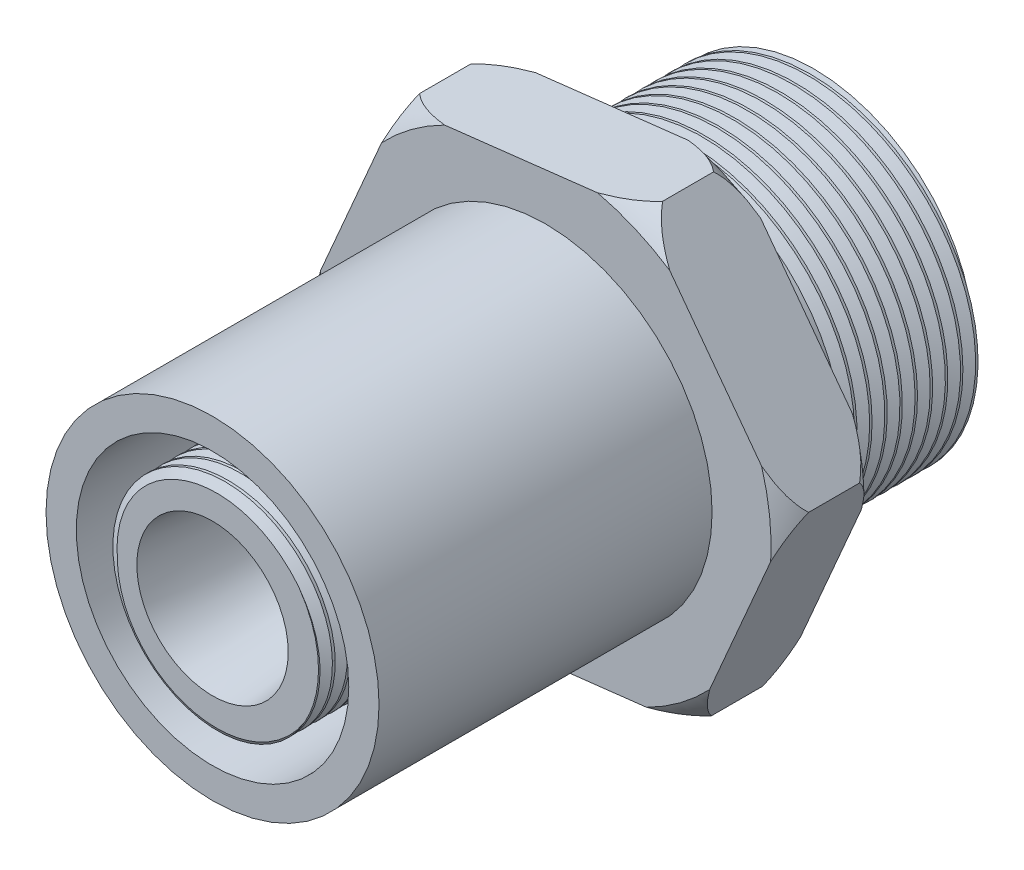
from build123d import *

# Parameters (mm, degrees)
SKETCH1_R           = 2.75
BOSS_EXTRUDE1_DEPTH = 10
CUT_SWEEP1_PITCH    = 0.25
SKETCH4_R           = 3.488114234
SKETCH4_R_2         = 2.4
CUT_EXTRUDE2_DEPTH  = 0.5
BOSS_EXTRUDE3_DEPTH = 1.5
SKETCH7_R           = 0.5
CUT_EXTRUDE3_DEPTH  = 11.5
SKETCH8_R           = 1.25
CUT_EXTRUDE4_DEPTH  = 5.5
CUT_EXTRUDE4_DRAFT  = -6
SKETCH9_R           = 1.25
CUT_EXTRUDE5_DEPTH  = 2
SKETCH12_R          = 2.25
SKETCH12_R_2        = 1.75
CUT_EXTRUDE6_DEPTH  = 4
CUT_SWEEP3_PITCH    = 0.25


with BuildPart() as part:
    # Sketch1 → Boss-Extrude1 (new body)
    with BuildSketch(Plane.XY):
        Circle(SKETCH1_R)
    extrude(amount=BOSS_EXTRUDE1_DEPTH)

    # Cut-Sweep1: arcs per turn and ends read off the stored shape
    # Cut-Sweep1: the profile of Sketch3 screwed along a right-hand helix through 11 turns, 6 arcs to a turn; built about Z, then put on its axis
    cut_sweep1_z = Axis((0, 0, 0), (0, 0, 1))
    cut_sweep1_corners = [(2.567921771, -4.9616e-05, -0.246570801), (2.75844736, -0.001640999, -0.136582313), (2.75844736, 0.001541767, -0.356559289)]
    with BuildLine(mode=Mode.PRIVATE) as cut_sweep1_profile:
        Line(cut_sweep1_corners[0], cut_sweep1_corners[1])
        Line(cut_sweep1_corners[1], cut_sweep1_corners[2])
        Line(cut_sweep1_corners[2], cut_sweep1_corners[0])
    cut_sweep1_cap = Face(cut_sweep1_profile.wire())
    cut_sweep1_turn_angles = [0, 30, 60, 90, 120, 150, 180, 210, 240, 270, 300, 330, 360]
    cut_sweep1_turn_weights = [1, 0.8660254037844387, 1, 0.8660254037844387, 1, 0.8660254037844387, 1, 0.8660254037844387, 1, 0.8660254037844387, 1, 0.8660254037844387, 1]
    cut_sweep1_turn_rails = [Edge.make_bspline([Vector(p[0], p[1], 0).rotate(cut_sweep1_z, cut_sweep1_turn_angles[k]) / cut_sweep1_turn_weights[k] + Vector(0, 0, p[2] + CUT_SWEEP1_PITCH * cut_sweep1_turn_angles[k] / 360) for k in range(13)], [0, 0, 0, 1, 1, 2, 2, 3, 3, 4, 4, 5, 5, 6, 6, 6], 2, cut_sweep1_turn_weights) for p in cut_sweep1_corners]
    cut_sweep1_turn_sides = [Face.make_surface_from_curves(cut_sweep1_turn_rails[p[0]], cut_sweep1_turn_rails[p[1]]) for p in [(0, 1), (1, 2), (2, 0)]]
    cut_sweep1 = Plane(origin=(0, 0, 0), x_dir=(1, 0, 0), z_dir=(0, 0, 1)) * Solid(Shell([*[p.moved(Location((0, 0, CUT_SWEEP1_PITCH * i))) for i in range(11) for p in cut_sweep1_turn_sides], cut_sweep1_cap, cut_sweep1_cap.rotate(cut_sweep1_z, 3960).moved(Location((0, 0, CUT_SWEEP1_PITCH * 3960 / 360)))]))
    add(cut_sweep1, mode=Mode.SUBTRACT)

    # Sketch4 → Cut-Extrude2 (cut)
    with BuildSketch(Plane(origin=(0, 0, 2.5), x_dir=(-1, 0, 0), z_dir=(0, 0, -1))):
        Circle(SKETCH4_R)
        Circle(SKETCH4_R_2, mode=Mode.SUBTRACT)
    extrude(amount=-CUT_EXTRUDE2_DEPTH, mode=Mode.SUBTRACT)

    # Sketch5 → Boss-Extrude3 (add)
    with BuildSketch(Plane(origin=(0, 0, 3), x_dir=(-1, 0, 0), z_dir=(0, 0, -1))):
        Polygon((-1.602981339, 3.709957434), (-4.014408054, 0.466756156), (-2.411426715, -3.243201278), (1.602981339, -3.709957434), (4.014408054, -0.466756156), (2.411426715, 3.243201278), align=None)
    extrude(amount=-BOSS_EXTRUDE3_DEPTH)

    # Sketch7 → Cut-Extrude3 (cut)
    with BuildSketch(Plane(origin=(0, 0, 0), x_dir=(-1, 0, 0), z_dir=(0, 0, -1))):
        Circle(SKETCH7_R)
    extrude(amount=-CUT_EXTRUDE3_DEPTH, mode=Mode.SUBTRACT)


with BuildPart() as cut_extrude4_tool:
    # Sketch8 → Cut-Extrude4 (with draft: the straight prism first)
    with BuildSketch(Plane.XY.offset(10)):
        Circle(SKETCH8_R)
    extrude(amount=-CUT_EXTRUDE4_DEPTH)
    # Cut-Extrude4: the draft: its side faces are tilted about the plane it starts from
    cut_extrude4_sides = [cut_extrude4_tool.faces().sort_by_distance(p)[0] for p in [
        (-1.25, 0, 7.25),
    ]]
    draft(cut_extrude4_sides, Plane.XY.offset(10), CUT_EXTRUDE4_DRAFT)


with BuildPart() as part_1:
    add(part.part)

    # Cut-Extrude4: cut by cut_extrude4_tool
    add(cut_extrude4_tool.part, mode=Mode.SUBTRACT)

    # Sketch9 → Cut-Extrude5 (cut)
    with BuildSketch(Plane(origin=(0, 0, 0), x_dir=(-1, 0, 0), z_dir=(0, 0, -1))):
        Circle(SKETCH9_R)
    extrude(amount=-CUT_EXTRUDE5_DEPTH, mode=Mode.SUBTRACT)

    # Cut-Sweep2: sweep along a path in Sketch10
    with BuildLine(Plane(origin=(0, 0, 3), x_dir=(-1, 0, 0), z_dir=(0, 0, -1))) as cut_sweep2_path:
        CenterArc((0, 0), 4.041451884, 0, 360)
    # Sketch11 → Cut-Sweep2 (sweep, cut)
    with BuildSketch(Plane(origin=(0, 0, 0), x_dir=(0, 0, -1), z_dir=(0.9179763956204893, -0.3966350174702367, 0))):
        with BuildLine():
            Line((-2.834975364, -3.12860287), (-2.834975364, -4.185126011))
            Line((-2.834975364, -4.185126011), (-3.498458729, -4.185126011))
            Line((-3.498458729, -4.185126011), (-3.498458729, -4.11904167))
            add(Edge.make_bspline(
                [(-2.834975364, -3.12860287), (-2.86365135, -3.638982988), (-3.084812471, -3.969129255), (-3.498458729, -4.11904167)],
                knots=[0, 0, 0, 0, 0.839891733, 0.839891733, 0.839891733, 0.839891733], degree=3))
        make_face()
        with BuildLine():
            Line((-4.001541271, -4.11904167), (-4.001541271, -4.185126011))
            Line((-4.001541271, -4.185126011), (-4.665024636, -4.185126011))
            Line((-4.665024636, -4.185126011), (-4.665024636, -3.12860287))
            add(Edge.make_bspline(
                [(-4.665024636, -3.12860287), (-4.63634865, -3.638982988), (-4.415187529, -3.969129255), (-4.001541271, -4.11904167)],
                knots=[0, 0, 0, 0, 0.839891733, 0.839891733, 0.839891733, 0.839891733], degree=3))
        make_face()
    sweep(path=cut_sweep2_path.line, mode=Mode.SUBTRACT)

    # Sketch12 → Cut-Extrude6 (cut)
    with BuildSketch(Plane.XY.offset(10)):
        Circle(SKETCH12_R)
        Circle(SKETCH12_R_2, mode=Mode.SUBTRACT)
    extrude(amount=-CUT_EXTRUDE6_DEPTH, mode=Mode.SUBTRACT)

    # Cut-Sweep3: arcs per turn and ends read off the stored shape
    # Cut-Sweep3: the profile of Sketch14 screwed along a right-hand helix through 15 turns, 6 arcs to a turn; built about Z, then put on its axis
    cut_sweep3_z = Axis((0, 0, 0), (0, 0, 1))
    cut_sweep3_corners = [(1.572572158, -4.747e-05, -0.247912143), (1.763097747, -0.00254783, -0.137940564), (1.763097747, 0.00245289, -0.357883722)]
    with BuildLine(mode=Mode.PRIVATE) as cut_sweep3_profile:
        Line(cut_sweep3_corners[0], cut_sweep3_corners[1])
        Line(cut_sweep3_corners[1], cut_sweep3_corners[2])
        Line(cut_sweep3_corners[2], cut_sweep3_corners[0])
    cut_sweep3_cap = Face(cut_sweep3_profile.wire())
    cut_sweep3_turn_angles = [0, 30, 60, 90, 120, 150, 180, 210, 240, 270, 300, 330, 360]
    cut_sweep3_turn_weights = [1, 0.8660254037844387, 1, 0.8660254037844387, 1, 0.8660254037844387, 1, 0.8660254037844387, 1, 0.8660254037844387, 1, 0.8660254037844387, 1]
    cut_sweep3_turn_rails = [Edge.make_bspline([Vector(p[0], p[1], 0).rotate(cut_sweep3_z, cut_sweep3_turn_angles[k]) / cut_sweep3_turn_weights[k] + Vector(0, 0, p[2] + CUT_SWEEP3_PITCH * cut_sweep3_turn_angles[k] / 360) for k in range(13)], [0, 0, 0, 1, 1, 2, 2, 3, 3, 4, 4, 5, 5, 6, 6, 6], 2, cut_sweep3_turn_weights) for p in cut_sweep3_corners]
    cut_sweep3_turn_sides = [Face.make_surface_from_curves(cut_sweep3_turn_rails[p[0]], cut_sweep3_turn_rails[p[1]]) for p in [(0, 1), (1, 2), (2, 0)]]
    cut_sweep3 = Plane(origin=(0, 0, 10), x_dir=(-1, 0, 0), z_dir=(0, 0, -1)) * Solid(Shell([*[p.moved(Location((0, 0, CUT_SWEEP3_PITCH * i))) for i in range(15) for p in cut_sweep3_turn_sides], cut_sweep3_cap, cut_sweep3_cap.rotate(cut_sweep3_z, 5400).moved(Location((0, 0, CUT_SWEEP3_PITCH * 5400 / 360)))]))
    add(cut_sweep3, mode=Mode.SUBTRACT)


solid = part_1.part
